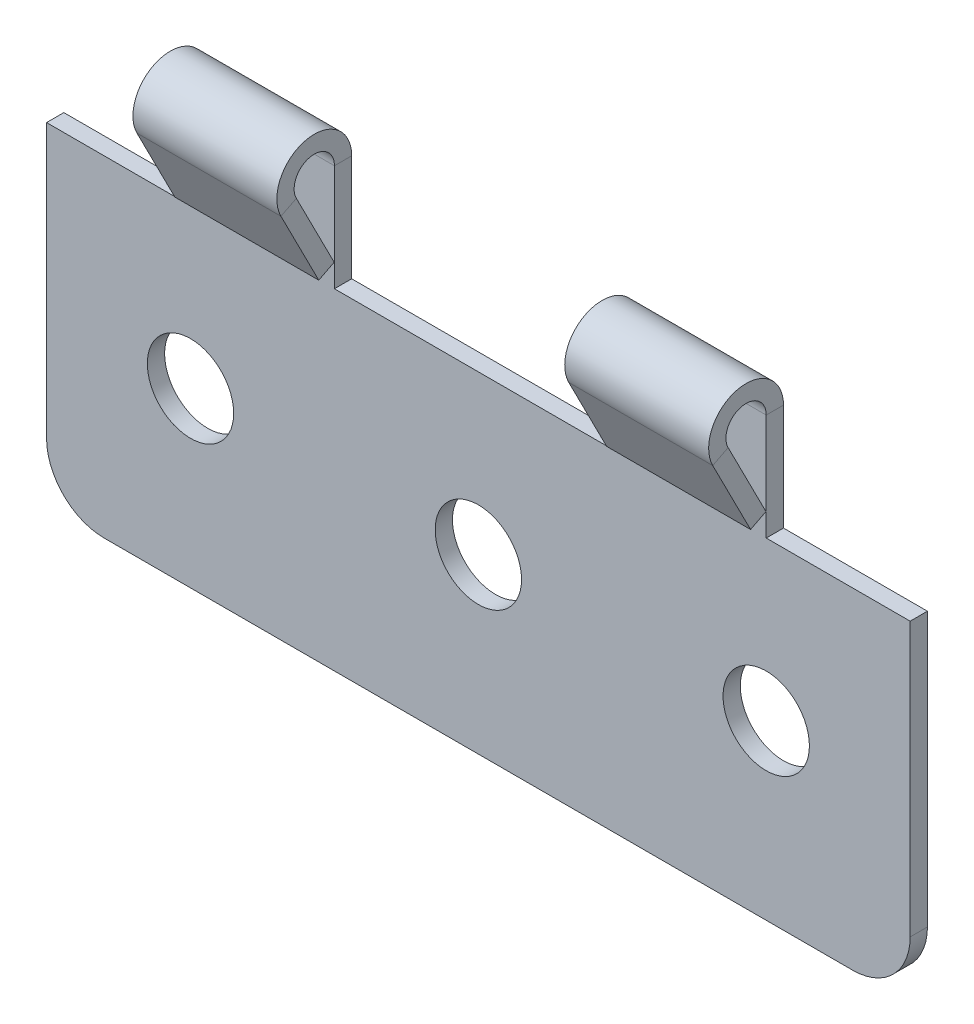
from build123d import *

# Parameters (mm, degrees)
BASE_FLANGE1_DEPTH = 6
HEM1_START         = 50
HEM1_DEPTH         = 200
HEM1_2_DEPTH       = 50
HEM1_START_2       = 200
HEM1_3_DEPTH       = 50
SKETCH11_R         = 15
CUT_EXTRUDE1_DEPTH = 10


# Read off the part's stored shape, not the designer's step: Hem1
# Sheet-metal steps are written as plain solids
with BuildPart() as part:
    # Sketch2 → Base-Flange1 (new body)
    with BuildSketch(Plane.XY):
        with BuildLine():
            Line((20, 0), (280, 0))
            ThreePointArc((280, 0), (294.142135624, 5.857864376), (300, 20))
            Line((300, 20), (300, 115))
            Line((300, 115), (250, 115))
            Line((250, 115), (250, 165))
            Line((250, 165), (200, 165))
            Line((200, 165), (200, 115))
            Line((200, 115), (100, 115))
            Line((100, 115), (100, 165))
            Line((100, 165), (50, 165))
            Line((50, 165), (50, 115))
            Line((50, 115), (0, 115))
            Line((0, 115), (0, 20))
            ThreePointArc((0, 20), (5.857864376, 5.857864376), (20, 0))
        make_face()
    extrude(amount=-BASE_FLANGE1_DEPTH)

    # Hem1 outline → Hem1 (cut)
    with BuildSketch(Plane.YZ.offset(HEM1_START)):
        with BuildLine():
            Line((165, 0), (162.95445115, 0))
            ThreePointArc((162.95445115, 0), (158.244997998, -4.401754251), (152, -6))
            Line((152, -6), (165, -6))
            Line((165, -6), (165, 0))
        make_face()
    extrude(amount=HEM1_DEPTH, mode=Mode.SUBTRACT)

    # Hem1 2 outline → Hem1 2 (add)
    with BuildSketch(Plane.YZ.offset(HEM1_START)):
        with BuildLine():
            Line((120.297159916, 5.436837245), (123.021102914, 0.0907981))
            Line((123.021102914, 0.0907981), (148.822066502, 13.237045669))
            ThreePointArc((148.822066502, 13.237045669), (158.806589443, 8.634117547), (152, 0))
            Line((152, 0), (162.95445115, 0))
            ThreePointArc((162.95445115, 0), (161.628857043, 15.734134876), (146.098123503, 18.583084814))
            Line((146.098123503, 18.583084814), (120.297159916, 5.436837245))
        make_face()
    extrude(amount=HEM1_2_DEPTH)

    # Hem1 3 outline → Hem1 3 (add)
    with BuildSketch(Plane.YZ.offset(HEM1_START_2)):
        with BuildLine():
            Line((120.297159916, 5.436837245), (123.021102914, 0.0907981))
            Line((123.021102914, 0.0907981), (148.822066502, 13.237045669))
            ThreePointArc((148.822066502, 13.237045669), (158.806589443, 8.634117547), (152, 0))
            Line((152, 0), (162.95445115, 0))
            ThreePointArc((162.95445115, 0), (161.628857043, 15.734134876), (146.098123503, 18.583084814))
            Line((146.098123503, 18.583084814), (120.297159916, 5.436837245))
        make_face()
    extrude(amount=HEM1_3_DEPTH)

    # Sketch11 → Cut-Extrude1 (cut)
    with BuildSketch(Plane.XY):
        with Locations((250, 60)):
            Circle(SKETCH11_R)
        with Locations((150, 60)):
            Circle(SKETCH11_R)
        with Locations((50, 60)):
            Circle(SKETCH11_R)
    extrude(amount=-CUT_EXTRUDE1_DEPTH, mode=Mode.SUBTRACT)


solid = part.part
